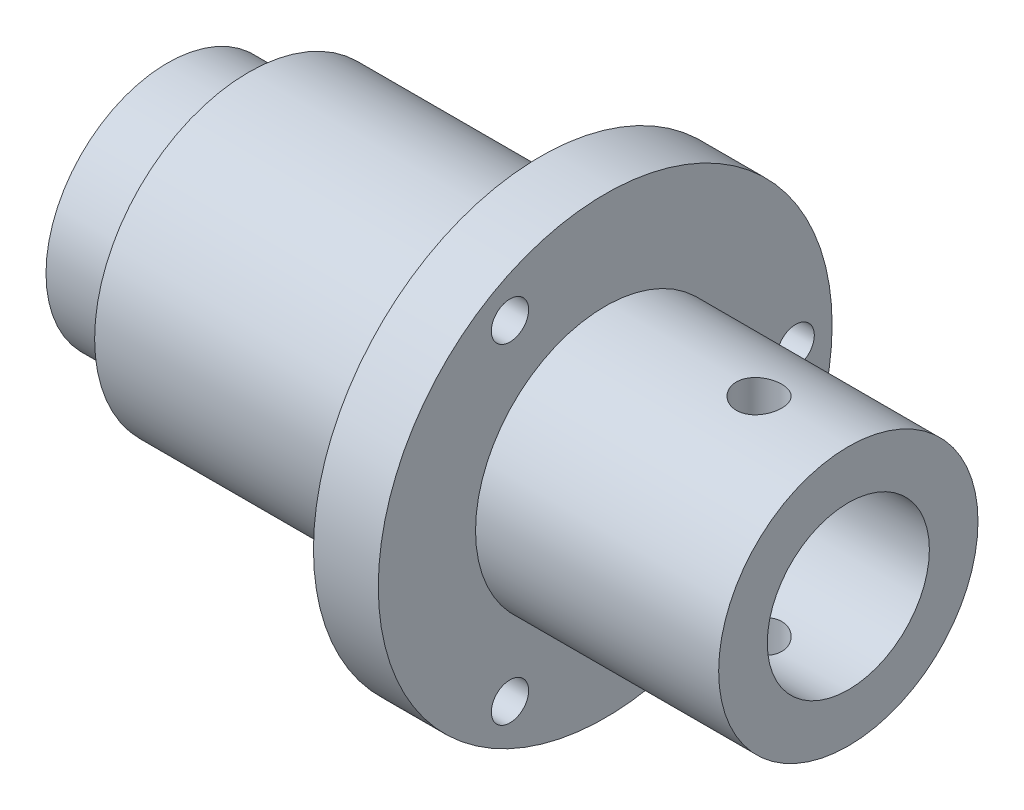
from build123d import *

# Parameters (mm, degrees)
SKETCH2_R           = 1.15
CUT_EXTRUDE1_DEPTH  = 31.347981811
CIRPATTERN1_COUNT   = 3
BOSS_EXTRUDE1_START = 15
SKETCH3_R           = 8
SKETCH3_R_2         = 5
BOSS_EXTRUDE1_DEPTH = 15
SKETCH4_R           = 1.4
CUT_EXTRUDE2_DEPTH  = 15


with BuildPart() as part:
    # Sketch1 → Revolve1 (revolve)
    with BuildSketch(Plane(origin=(0, 0, 0), x_dir=(1, 0, 0), z_dir=(0, 1, 0))):
        Polygon((0, 5), (27, 5), (27, 14), (23, 14), (23, 9.5), (5, 9.5), (5, 7.5), (0, 7.5), align=None)
    revolve(axis=Axis((0, 0, 0), (1, 0, 0)))

    # Sketch2 → Cut-Extrude1 (cut, through all)
    with BuildSketch(Plane.ZY.offset(-23)):
        with Locations((-11.75, 0)):
            Circle(SKETCH2_R)
    cut_extrude1 = extrude(amount=-CUT_EXTRUDE1_DEPTH, mode=Mode.SUBTRACT)

    # CirPattern1: Cut-Extrude1 ×3 about axis
    cirpattern1_axis = Axis((0, 0, 0), (-1, 0, 0))
    for i in range(1, CIRPATTERN1_COUNT):
        add(cut_extrude1.rotate(cirpattern1_axis, i * 360 / CIRPATTERN1_COUNT), mode=Mode.SUBTRACT)

    # Sketch3 → Boss-Extrude1 (add)
    with BuildSketch(Plane(origin=(27, 0, 0), x_dir=(0, 0, -1), z_dir=(1, 0, 0)).offset(BOSS_EXTRUDE1_START)):
        Circle(SKETCH3_R)
        Circle(SKETCH3_R_2, mode=Mode.SUBTRACT)
    extrude(amount=-BOSS_EXTRUDE1_DEPTH)

    # Sketch4 → Cut-Extrude2 (cut, symmetric)
    with BuildSketch(Plane(origin=(0, 0, 0), x_dir=(1, 0, 0), z_dir=(0, 1, 0))):
        with Locations((36.494397073, 0)):
            Circle(SKETCH4_R)
    extrude(amount=CUT_EXTRUDE2_DEPTH, both=True, mode=Mode.SUBTRACT)


solid = part.part
